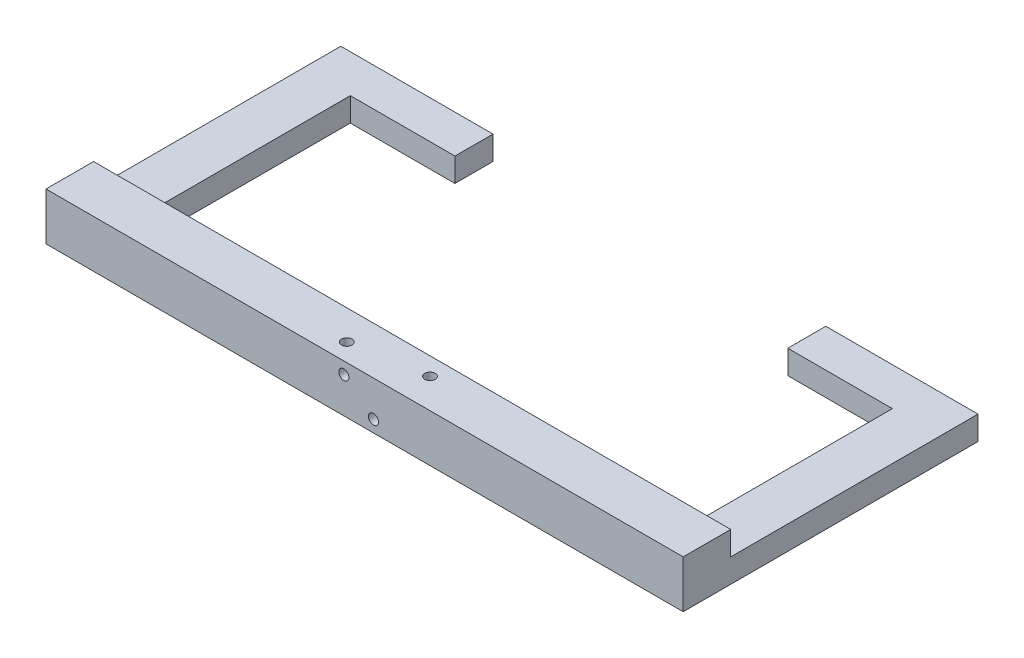
from build123d import *

# Parameters (mm, degrees)
BOSS_EXTRUDE2_DEPTH   = 6.35
BOSS_EXTRUDE2_2_DEPTH = 6.35
BOSS_EXTRUDE3_DEPTH   = 12.7
CUT_EXTRUDE2_REACH    = 189.943
SKETCH3_R             = 1.397
CUT_EXTRUDE3_REACH    = 184.986
SKETCH4_R             = 1.35255


with BuildPart() as part:
    # Sketch1 → Boss-Extrude2 (new body)
    with BuildSketch(Plane(origin=(0, 0, 0), x_dir=(1, 0, 0), z_dir=(0, 1, 0))):
        Polygon((12.7, 68.58), (40.64, 68.58), (40.64, 78.74), (0, 78.74), (0, 12.7), (12.7, 12.7), align=None)
    extrude(amount=BOSS_EXTRUDE2_DEPTH)



with BuildPart() as body_2:
    # Sketch1 → Boss-Extrude2 2 (new body)
    with BuildSketch(Plane(origin=(0, 0, 0), x_dir=(1, 0, 0), z_dir=(0, 1, 0))):
        Polygon((157.48, 68.58), (157.48, 12.7), (170.18, 12.7), (170.18, 78.74), (129.54, 78.74), (129.54, 68.58), align=None)
    extrude(amount=BOSS_EXTRUDE2_2_DEPTH)


with BuildPart() as part_1:
    add(part.part)

    add(body_2.part)  # Boss-Extrude3 merges body 2
    # Sketch1<3> → Boss-Extrude3 (add)
    with BuildSketch(Plane(origin=(0, 0, 0), x_dir=(1, 0, 0), z_dir=(0, 1, 0))):
        Polygon((157.48, 12.7), (12.7, 12.7), (0, 12.7), (0, 0), (170.18, 0), (170.18, 12.7), align=None)
    extrude(amount=BOSS_EXTRUDE3_DEPTH)

    # Sketch3 → Cut-Extrude2 (cut, up to next)
    with BuildSketch(Plane(origin=(0, 12.7, 0), x_dir=(1, 0, 0), z_dir=(0, 1, 0)), mode=Mode.PRIVATE) as cut_extrude2_sk1:
        with Locations((75.565, 4.7625)):
            Circle(SKETCH3_R)
    cut_extrude2_tool1 = extrude(cut_extrude2_sk1.sketch, amount=-CUT_EXTRUDE2_REACH, mode=Mode.PRIVATE) & part_1.part
    # Sketch3 → Cut-Extrude2 (cut, up to next)
    with BuildSketch(Plane(origin=(0, 12.7, 0), x_dir=(1, 0, 0), z_dir=(0, 1, 0)), mode=Mode.PRIVATE) as cut_extrude2_sk2:
        with Locations((94.615, 7.9375)):
            Circle(SKETCH3_R)
    cut_extrude2_tool2 = extrude(cut_extrude2_sk2.sketch, amount=-CUT_EXTRUDE2_REACH, mode=Mode.PRIVATE) & part_1.part
    add(cut_extrude2_tool1.solids().sort_by_distance((75.565, 12.7, -4.7625))[0], mode=Mode.SUBTRACT)
    add(cut_extrude2_tool2.solids().sort_by_distance((94.615, 12.7, -7.9375))[0], mode=Mode.SUBTRACT)

    # Sketch4 → Cut-Extrude3 (cut, up to next)
    with BuildSketch(Plane(origin=(0, 0, -12.7), x_dir=(-1, 0, 0), z_dir=(0, 0, -1)), mode=Mode.PRIVATE) as cut_extrude3_sk1:
        with Locations((-87.4776, 3.175)):
            Circle(SKETCH4_R)
    cut_extrude3_tool1 = extrude(cut_extrude3_sk1.sketch, amount=-CUT_EXTRUDE3_REACH, mode=Mode.PRIVATE) & part_1.part
    # Sketch4 → Cut-Extrude3 (cut, up to next)
    with BuildSketch(Plane(origin=(0, 0, -12.7), x_dir=(-1, 0, 0), z_dir=(0, 0, -1)), mode=Mode.PRIVATE) as cut_extrude3_sk2:
        with Locations((-79.546452542, 9.525)):
            Circle(SKETCH4_R)
    cut_extrude3_tool2 = extrude(cut_extrude3_sk2.sketch, amount=-CUT_EXTRUDE3_REACH, mode=Mode.PRIVATE) & part_1.part
    add(cut_extrude3_tool1.solids().sort_by_distance((87.4776, 3.175, -12.7))[0], mode=Mode.SUBTRACT)
    add(cut_extrude3_tool2.solids().sort_by_distance((79.546453, 9.525, -12.7))[0], mode=Mode.SUBTRACT)


solid = part_1.part
